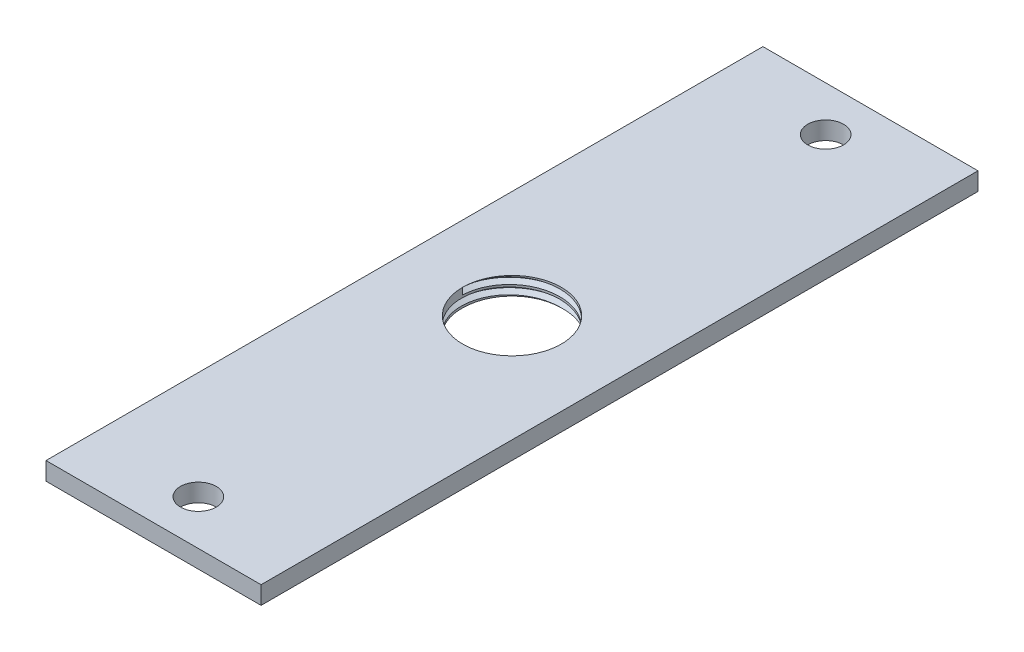
from build123d import *

# Parameters (mm, degrees)
SKETCH1_W           = 38.1
SKETCH1_H           = 127
BOSS_EXTRUDE1_DEPTH = 1.5875
SKETCH2_R           = 8.73125
CUT_EXTRUDE1_DEPTH  = 19.05
SKETCH3_R           = 3.175
CUT_EXTRUDE2_DEPTH  = 3.175
THREAD1_PITCH       = 1.5875


with BuildPart() as part:
    # Sketch1 → Boss-Extrude1 (new, symmetric)
    with BuildSketch(Plane(origin=(0, 0, 0), x_dir=(1, 0, 0), z_dir=(0, 1, 0))):
        Rectangle(SKETCH1_W, SKETCH1_H)
    extrude(amount=BOSS_EXTRUDE1_DEPTH, both=True)

    # Sketch2 → Cut-Extrude1 (cut)
    with BuildSketch(Plane(origin=(0, 1.5875, 0), x_dir=(1, 0, 0), z_dir=(0, 1, 0))):
        with Locations(Location((0, 0, 0), (0, 0, 270))):
            Circle(SKETCH2_R)
    extrude(amount=-CUT_EXTRUDE1_DEPTH, mode=Mode.SUBTRACT)

    # Sketch3 → Cut-Extrude2 (cut)
    with BuildSketch(Plane(origin=(0, 1.5875, 0), x_dir=(1, 0, 0), z_dir=(0, 1, 0))):
        with Locations(Location((0, 55.5625, 0), (0, 0, 270))):
            Circle(SKETCH3_R)
        with Locations(Location((0, -55.5625, 0), (0, 0, 90))):
            Circle(SKETCH3_R)
    extrude(amount=-CUT_EXTRUDE2_DEPTH, mode=Mode.SUBTRACT)

    # Thread1: the profile of Thread Profile1 profile screwed along a right-hand helix of 2 turns, 8 arcs to a turn; built about Z, then put on its axis
    thread1_z = Axis((0, 0, 0), (0, 0, 1))
    thread1_corners = [(8.73095, 0, -0.000173205), (9.590509577, 0, 0.496093748), (9.590509577, 0, 0.694531248), (8.73095, 0, 1.190798201)]
    with BuildLine(mode=Mode.PRIVATE) as thread1_profile:
        Line(thread1_corners[0], thread1_corners[1])
        Line(thread1_corners[1], thread1_corners[2])
        Line(thread1_corners[2], thread1_corners[3])
        Line(thread1_corners[3], thread1_corners[0])
    thread1_cap = Face(thread1_profile.wire())
    thread1_turn_angles = [0, 22.5, 45, 67.5, 90, 112.5, 135, 157.5, 180, 202.5, 225, 247.5, 270, 292.5, 315, 337.5, 360]
    thread1_turn_weights = [1, 0.9238795325112867, 1, 0.9238795325112867, 1, 0.9238795325112867, 1, 0.9238795325112867, 1, 0.9238795325112867, 1, 0.9238795325112867, 1, 0.9238795325112867, 1, 0.9238795325112867, 1]
    thread1_turn_rails = [Edge.make_bspline([Vector(p[0], p[1], 0).rotate(thread1_z, thread1_turn_angles[k]) / thread1_turn_weights[k] + Vector(0, 0, p[2] + THREAD1_PITCH * thread1_turn_angles[k] / 360) for k in range(17)], [0, 0, 0, 1, 1, 2, 2, 3, 3, 4, 4, 5, 5, 6, 6, 7, 7, 8, 8, 8], 2, thread1_turn_weights) for p in thread1_corners]
    thread1_turn_sides = [Face.make_surface_from_curves(thread1_turn_rails[p[0]], thread1_turn_rails[p[1]]) for p in [(0, 1), (1, 2), (2, 3), (3, 0)]]
    thread1 = Plane(origin=(0, 1.5875, 0), x_dir=(-1, 0, 0), z_dir=(0, -1, 0)) * Solid(Shell([*[p.moved(Location((0, 0, THREAD1_PITCH * i))) for i in range(2) for p in thread1_turn_sides], thread1_cap, thread1_cap.rotate(thread1_z, 720).moved(Location((0, 0, THREAD1_PITCH * 720 / 360)))]))
    add(thread1, mode=Mode.SUBTRACT)


solid = part.part
